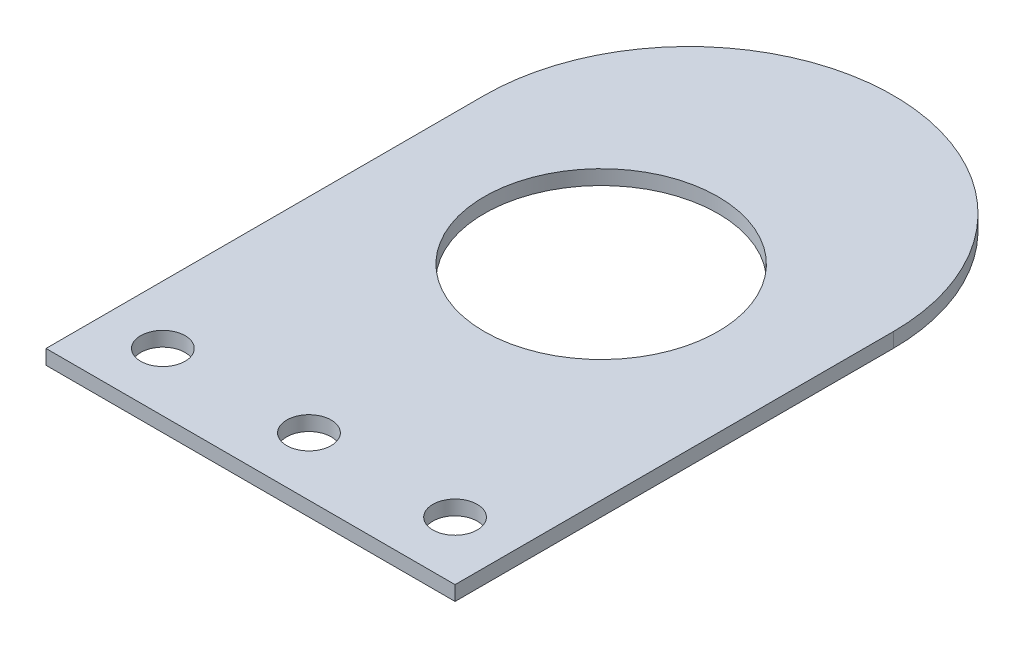
from build123d import *

# Parameters (mm, degrees)
SKETCH1_R          = 12.7
BASE_FLANGE1_DEPTH = 1.5875
SKETCH12_R         = 2.413
CUT_EXTRUDE1_DEPTH = 53.579572138


# Sheet-metal steps are written as plain solids
with BuildPart() as part:
    # Sketch1 → Base-Flange1 (new body)
    with BuildSketch(Plane(origin=(0, 0, 0), x_dir=(1, 0, 0), z_dir=(0, 1, 0))):
        with BuildLine():
            Line((-22.225, 0), (-22.225, -47.625))
            Line((-22.225, -47.625), (22.225, -47.625))
            Line((22.225, -47.625), (22.225, 0))
            ThreePointArc((22.225, 0), (0, 22.225), (-22.225, 0))
        make_face()
        with Locations(Location((0, -9.525, 0), (0, 0, 270))):
            Circle(SKETCH1_R, mode=Mode.SUBTRACT)
    extrude(amount=-BASE_FLANGE1_DEPTH)

    # Sketch12 → Cut-Extrude1 (cut, through all)
    with BuildSketch(Plane.XZ.offset(1.5875)):
        with Locations(Location((15.875, 41.275, 0), (0, 0, 270))):
            Circle(SKETCH12_R)
        with Locations(Location((0, 41.275, 0), (0, 0, 270))):
            Circle(SKETCH12_R)
        with Locations(Location((-15.875, 41.275, 0), (0, 0, 270))):
            Circle(SKETCH12_R)
    extrude(amount=-CUT_EXTRUDE1_DEPTH, mode=Mode.SUBTRACT)


solid = part.part
